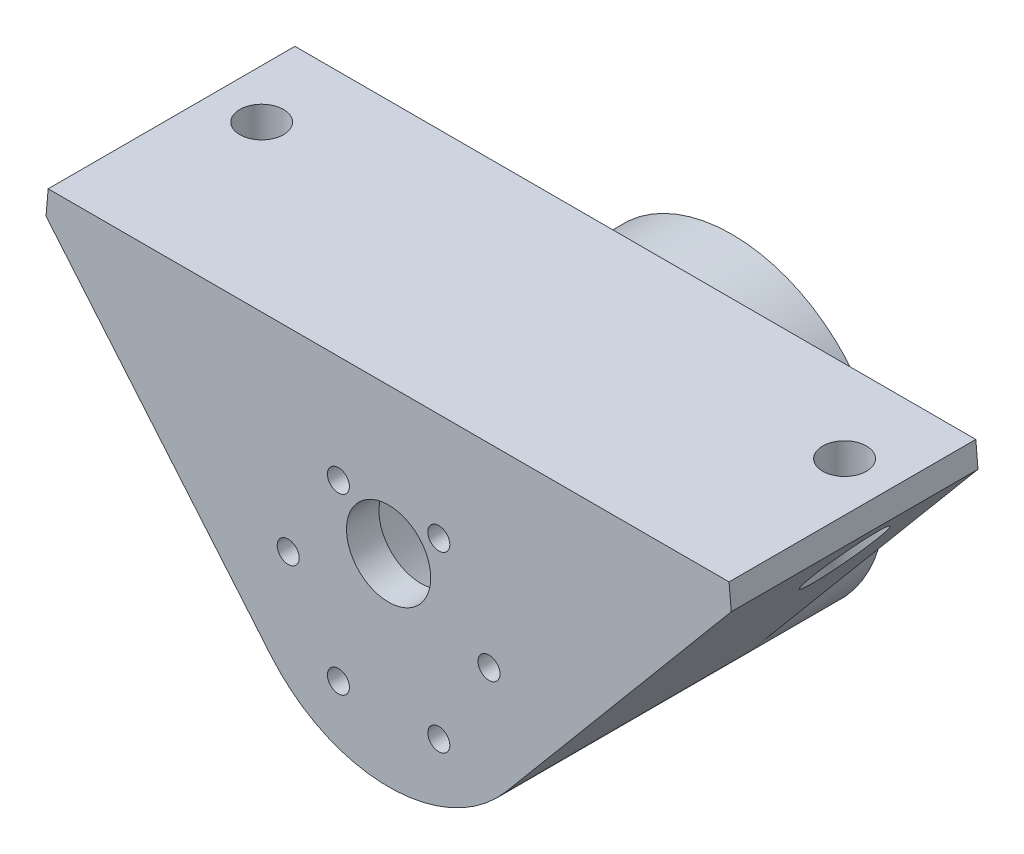
from build123d import *
from OCP.BRepFilletAPI import BRepFilletAPI_MakeChamfer

# Parameters (mm, degrees)
SKETCH1_R               = 23.7
SKETCH1_R_2             = 18.7
BOSS_EXTRUDE1_DEPTH     = 48
BOSS_EXTRUDE2_START     = 5
SKETCH1_3_R             = 23.7
SKETCH1_3_R_2           = 6.5
BOSS_EXTRUDE2_DEPTH     = 5
M3_CLEARANCE_HOLE1_D    = 3.4
CIRPATTERN1_COUNT       = 6
BOSS_EXTRUDE3_DEPTH     = 38.1
F_1_4_CLEARANCE_HOLE1_D = 6.7564
SKETCH9_R               = 4.953
CUT_EXTRUDE1_DEPTH      = 89.454226705
CHAMFER1_SIZE           = 5
CHAMFER1_SIZE2          = 3.549039071


with BuildPart() as part:
    # Sketch1 → Boss-Extrude1 (new body)
    with BuildSketch(Plane.XY):
        Circle(SKETCH1_R)
        Circle(SKETCH1_R_2, mode=Mode.SUBTRACT)
    extrude(amount=-BOSS_EXTRUDE1_DEPTH)

    # Sketch1<3> → Boss-Extrude2 (add)
    with BuildSketch(Plane.XY.offset(BOSS_EXTRUDE2_START)):
        Circle(SKETCH1_3_R)
        with Locations((0, 7.5)):
            Circle(SKETCH1_3_R_2, mode=Mode.SUBTRACT)
    extrude(amount=-BOSS_EXTRUDE2_DEPTH)

    # M3 Clearance Hole1 (through all)
    with Locations(Plane.XY.offset(5)):
        with Locations((-15.5, 0)):
            m3_clearance_hole1 = Hole(M3_CLEARANCE_HOLE1_D / 2)

    # CirPattern1: M3 Clearance Hole1 ×6 about axis
    cirpattern1_axis = Axis((0, 0, -48), (0, 0, 1))
    for i in range(1, CIRPATTERN1_COUNT):
        add(m3_clearance_hole1.rotate(cirpattern1_axis, i * 360 / CIRPATTERN1_COUNT), mode=Mode.SUBTRACT)

    # Sketch5 → Boss-Extrude3 (add)
    with BuildSketch(Plane.XY.offset(5)):
        with BuildLine():
            Line((56.111141692, 30), (-56.111141692, 30))
            Line((-56.111141692, 30), (-18.155253302, -15.23406635))
            ThreePointArc((-18.155253302, -15.23406635), (-8.105877397, 22.270715113), (23.7, 0))
            ThreePointArc((23.7, 0), (22.270715113, -8.105877397), (18.155253302, -15.23406635))
            Line((18.155253302, -15.23406635), (56.111141692, 30))
        make_face()
    extrude(amount=-BOSS_EXTRUDE3_DEPTH)

    # 1/4 Clearance Hole1 (through all)
    with Locations(Plane(origin=(0, 30, 0), x_dir=(1, 0, 0), z_dir=(0, 1, 0))):
        with Locations((-45, 20.4), (45, 20.4)):
            Hole(F_1_4_CLEARANCE_HOLE1_D / 2)

    # Sketch9 → Cut-Extrude1 (cut, through all)
    with BuildSketch(Plane(origin=(0, 25, 0), x_dir=(1, 0, 0), z_dir=(0, 1, 0))):
        with Locations((-45, 20.4)):
            Circle(SKETCH9_R)
        with Locations((45, 20.4)):
            Circle(SKETCH9_R)
    extrude(amount=-CUT_EXTRUDE1_DEPTH, mode=Mode.SUBTRACT)

    # Chamfer1: one chamfer whose edges measure the first distance from different faces: ONE call of the kernel's chamfer builder (chamfer() names one face for all edges)
    chamfer1_edges_1 = [part.edges().sort_by_distance(p)[0] for p in [
        (56.111141692, 30, -14.05),
    ]]
    chamfer1_side_1 = [part.faces().sort_by_distance(p)[0] for p in [
        (36.690338228, 6.8551877, -13.692528669),
    ]]
    chamfer1_edges_2 = [part.edges().sort_by_distance(p)[0] for p in [
        (-56.111141692, 30, -14.05),
    ]]
    chamfer1_side_2 = [part.faces().sort_by_distance(p)[0] for p in [
        (-36.690338228, 6.8551877, -13.692528669),
    ]]
    chamfer1 = BRepFilletAPI_MakeChamfer(part.part.solid().wrapped)
    for e in chamfer1_edges_1:
        chamfer1.Add(CHAMFER1_SIZE, CHAMFER1_SIZE2, e.wrapped, chamfer1_side_1[0].wrapped)  # the first distance lies on this face
    for e in chamfer1_edges_2:
        chamfer1.Add(CHAMFER1_SIZE, CHAMFER1_SIZE2, e.wrapped, chamfer1_side_2[0].wrapped)  # the first distance lies on this face
    add(Compound.cast(chamfer1.Shape()), mode=Mode.REPLACE)


solid = part.part
